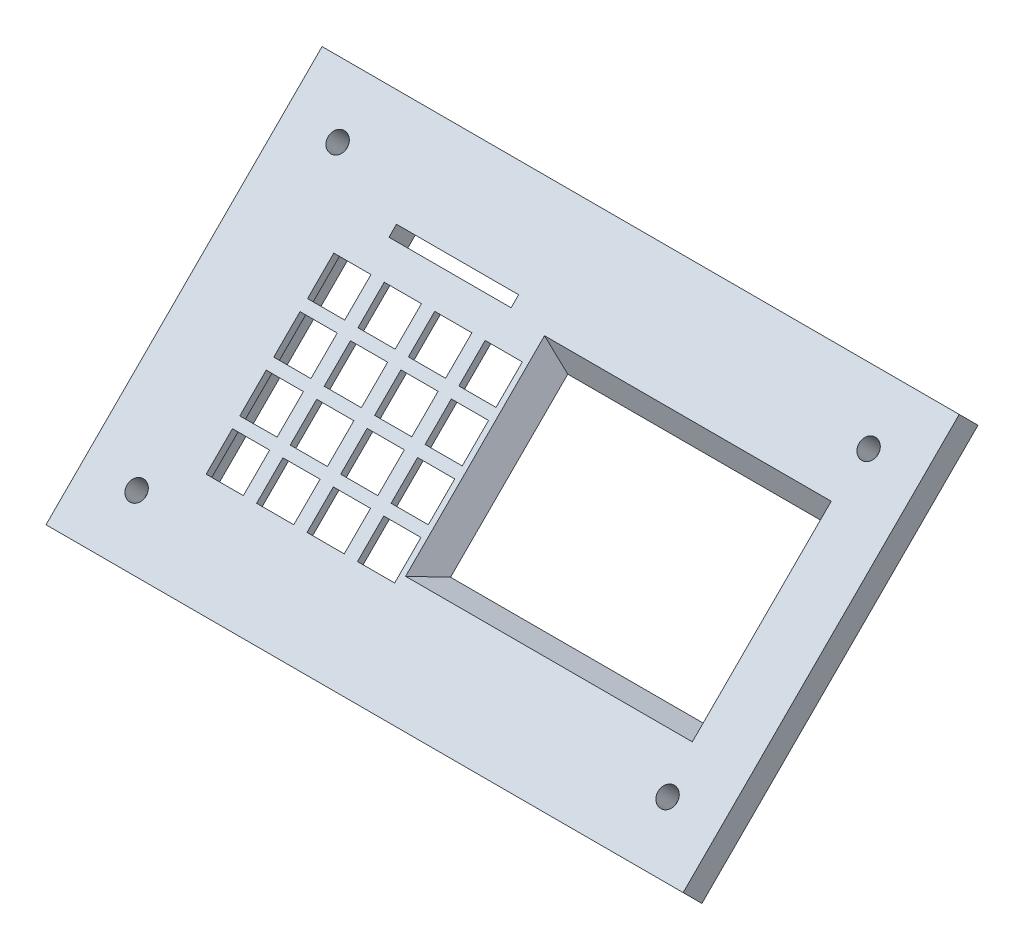
from build123d import *

# Parameters (mm, degrees)
SKETCH_1_W          = 120
SKETCH_1_H          = 73.539105243
SKETCH_1_R          = 1.8
SKETCH_1_W_2        = 48
SKETCH_1_H_2        = 31
SKETCH_1_W_3        = 23
SKETCH_1_H_3        = 2
SKETCH_1_W_4        = 7
SKETCH_1_H_4        = 7
SKETCH_1_H_5        = 7.044155877
EXTRUDE_1_DEPTH     = 5
SKETCH_2_W          = 37.5
SKETCH_2_H          = 36.110051057
CUT_EXTRUDE_1_DEPTH = 3.5


with BuildPart() as part:
    # Эскиз1 → Бобышка-Вытянуть1 (new body)
    with BuildSketch(Plane(origin=(0, 0, 0), x_dir=(1, 0, 0), z_dir=(0, 0.7071067811865477, 0.7071067811865475))):
        with Locations((60, 36.769552622)):
            Rectangle(SKETCH_1_W, SKETCH_1_H)
        with Locations(Location((10, 63.539105243, 0), (0, 0, 270))):
            Circle(SKETCH_1_R, mode=Mode.SUBTRACT)
        with Locations(Location((110, 63.539105243, 0), (0, 0, 270))):
            Circle(SKETCH_1_R, mode=Mode.SUBTRACT)
        with Locations(Location((110, 10, 0), (0, 0, 270))):
            Circle(SKETCH_1_R, mode=Mode.SUBTRACT)
        with Locations(Location((10, 10, 0), (0, 0, 270))):
            Circle(SKETCH_1_R, mode=Mode.SUBTRACT)
        with Locations((82, 36.5)):
            Rectangle(SKETCH_1_W_2, SKETCH_1_H_2, mode=Mode.SUBTRACT)
        with Locations((36.5, 57)):
            Rectangle(SKETCH_1_W_3, SKETCH_1_H_3, mode=Mode.SUBTRACT)
        with Locations((50.5, 47)):
            Rectangle(SKETCH_1_W_4, SKETCH_1_H_4, mode=Mode.SUBTRACT)
        with Locations((41, 47)):
            Rectangle(SKETCH_1_W_4, SKETCH_1_H_4, mode=Mode.SUBTRACT)
        with Locations((31.5, 47)):
            Rectangle(SKETCH_1_W_4, SKETCH_1_H_4, mode=Mode.SUBTRACT)
        with Locations((22, 47)):
            Rectangle(SKETCH_1_W_4, SKETCH_1_H_4, mode=Mode.SUBTRACT)
        with Locations((22, 38)):
            Rectangle(SKETCH_1_W_4, SKETCH_1_H_4, mode=Mode.SUBTRACT)
        Polygon((18.5, 32.5), (18.5, 25.455844123), (25.5, 25.5), (25.5, 32.5), align=None, mode=Mode.SUBTRACT)
        with Locations((22, 20)):
            Rectangle(SKETCH_1_W_4, SKETCH_1_H_4, mode=Mode.SUBTRACT)
        with Locations((31.5, 20)):
            Rectangle(SKETCH_1_W_4, SKETCH_1_H_4, mode=Mode.SUBTRACT)
        with Locations((41, 20)):
            Rectangle(SKETCH_1_W_4, SKETCH_1_H_4, mode=Mode.SUBTRACT)
        with Locations((50.5, 20)):
            Rectangle(SKETCH_1_W_4, SKETCH_1_H_4, mode=Mode.SUBTRACT)
        with Locations((50.5, 28.977922062)):
            Rectangle(SKETCH_1_W_4, SKETCH_1_H_5, mode=Mode.SUBTRACT)
        with Locations((41, 38)):
            Rectangle(SKETCH_1_W_4, SKETCH_1_H_4, mode=Mode.SUBTRACT)
        with Locations((50.5, 38)):
            Rectangle(SKETCH_1_W_4, SKETCH_1_H_4, mode=Mode.SUBTRACT)
        with Locations((31.5, 38)):
            Rectangle(SKETCH_1_W_4, SKETCH_1_H_4, mode=Mode.SUBTRACT)
        with Locations((31.5, 28.977922062)):
            Rectangle(SKETCH_1_W_4, SKETCH_1_H_5, mode=Mode.SUBTRACT)
        with Locations((41, 28.977922062)):
            Rectangle(SKETCH_1_W_4, SKETCH_1_H_5, mode=Mode.SUBTRACT)
    extrude(amount=EXTRUDE_1_DEPTH)

    # Фаска1
    # the kernel refuses this chamfer: 5.196152423, 3 mm, written as the material it takes off along each edge
    with BuildSketch(Plane(origin=(58, 18.384776311, -11.313708499), x_dir=(0.01932676561270104, -0.706974708221925, -0.7069747082219248), z_dir=(0, 0.7071067811865475, -0.7071067811865477)), Plane(origin=(106, 40.305086528, -33.234018716), x_dir=(-0.019326765612701025, -0.706974708221925, -0.7069747082219249), z_dir=(0, -0.7071067811865475, 0.7071067811865477))) as chamfer_1_piece_1:
        with BuildLine():
            Line((5.377156765, 0), (-0.239955173, 3.099864482))
            Line((-0.239955173, 3.099864482), (-0.343858811, 3.097855985))
            ThreePointArc((-0.343858811, 3.097855985), (-0.133898034, 1.549663153), (-0.103903638, -0.002008496))
            Line((-0.103903638, -0.002008496), (0.002008496, -0.103903638))
            ThreePointArc((0.002008496, -0.103903638), (2.689582631, -0.051951819), (5.379165261, -0.103903638))
            Line((5.379165261, -0.103903638), (5.377156765, 0))
        make_face()
    extrude(amount=31, mode=Mode.SUBTRACT)
    with BuildSketch(Plane(origin=(106, 18.384776311, -11.313708499), x_dir=(0, -0.6933086211987814, -0.7206407952450685), z_dir=(-1, 0, 0)), Plane(origin=(58, 40.305086528, -33.234018716), x_dir=(0, -0.7206407952450687, -0.693308621198781), z_dir=(1, 0, 0))) as chamfer_1_piece_2:
        with BuildLine():
            Line((5.377156765, 0), (-0.239955173, 3.099864482))
            Line((-0.239955173, 3.099864482), (-0.343858811, 3.097855985))
            ThreePointArc((-0.343858811, 3.097855985), (-0.133898034, 1.549663153), (-0.103903638, -0.002008496))
            Line((-0.103903638, -0.002008496), (0.002008496, -0.103903638))
            ThreePointArc((0.002008496, -0.103903638), (2.689582631, -0.051951819), (5.379165261, -0.103903638))
            Line((5.379165261, -0.103903638), (5.377156765, 0))
        make_face()
    extrude(amount=48, mode=Mode.SUBTRACT)
    with BuildSketch(Plane(origin=(106, 18.384776311, -11.313708499), x_dir=(0, -0.6933086211987814, -0.7206407952450685), z_dir=(-1, 0, 0))) as chamfer_1_piece_3a_section:
        with BuildLine():
            Line((5.377156765, 0), (-0.239955173, 3.099864482))
            Line((-0.239955173, 3.099864482), (-0.343858811, 3.097855985))
            ThreePointArc((-0.343858811, 3.097855985), (-0.133898034, 1.549663153), (-0.103903638, -0.002008496))
            Line((-0.103903638, -0.002008496), (0.002008496, -0.103903638))
            ThreePointArc((0.002008496, -0.103903638), (2.689582631, -0.051951819), (5.379165261, -0.103903638))
            Line((5.379165261, -0.103903638), (5.377156765, 0))
        make_face()
    chamfer_1_piece_3a = extrude(amount=61.442891912, mode=Mode.PRIVATE)
    chamfer_1_piece_3a = split(chamfer_1_piece_3a, bisect_by=Plane(origin=(58, 16.472259587, -11.865738078), z_dir=(-1, 0, 0)), keep=Keep.TOP, mode=Mode.PRIVATE)
    with BuildSketch(Plane(origin=(58, 8.879216281, -1.808148469), x_dir=(0.01932676561270103, -0.706974708221925, -0.7069747082219248), z_dir=(0, 0.7071067811865475, -0.7071067811865477))) as chamfer_1_piece_3b_section:
        with BuildLine():
            Line((5.377156765, 0), (-0.239955173, 3.099864482))
            Line((-0.239955173, 3.099864482), (-0.343858811, 3.097855985))
            ThreePointArc((-0.343858811, 3.097855985), (-0.133898034, 1.549663153), (-0.103903638, -0.002008496))
            Line((-0.103903638, -0.002008496), (0.002008496, -0.103903638))
            ThreePointArc((0.002008496, -0.103903638), (2.689582631, -0.051951819), (5.379165261, -0.103903638))
            Line((5.379165261, -0.103903638), (5.377156765, 0))
        make_face()
    chamfer_1_piece_3b = extrude(amount=44.442891912, mode=Mode.PRIVATE)
    chamfer_1_piece_3b = split(chamfer_1_piece_3b, bisect_by=Plane(origin=(57.037990314, 17.15250316, -12.54598165), z_dir=(0, -0.7071067811865475, 0.7071067811865477)), keep=Keep.TOP, mode=Mode.PRIVATE)
    chamfer_1_piece_3 = chamfer_1_piece_3a & chamfer_1_piece_3b
    add(chamfer_1_piece_3, mode=Mode.SUBTRACT)
    with BuildSketch(Plane(origin=(44.557108088, 40.305086528, -33.234018716), x_dir=(0, -0.7206407952450687, -0.693308621198781), z_dir=(1, 0, 0))) as chamfer_1_piece_4a_section:
        with BuildLine():
            Line((5.377156765, 0), (-0.239955173, 3.099864482))
            Line((-0.239955173, 3.099864482), (-0.343858811, 3.097855985))
            ThreePointArc((-0.343858811, 3.097855985), (-0.133898034, 1.549663153), (-0.103903638, -0.002008496))
            Line((-0.103903638, -0.002008496), (0.002008496, -0.103903638))
            ThreePointArc((0.002008496, -0.103903638), (2.689582631, -0.051951819), (5.379165261, -0.103903638))
            Line((5.379165261, -0.103903638), (5.377156765, 0))
        make_face()
    chamfer_1_piece_4a = extrude(amount=61.442891912, mode=Mode.PRIVATE)
    chamfer_1_piece_4a = split(chamfer_1_piece_4a, bisect_by=Plane(origin=(58, 39.753056949, -35.146535439), z_dir=(-1, 0, 0)), keep=Keep.TOP, mode=Mode.PRIVATE)
    with BuildSketch(Plane(origin=(58, 18.384776311, -11.313708499), x_dir=(0.01932676561270104, -0.706974708221925, -0.7069747082219248), z_dir=(0, 0.7071067811865475, -0.7071067811865477))) as chamfer_1_piece_4b_section:
        with BuildLine():
            Line((5.377156765, 0), (-0.239955173, 3.099864482))
            Line((-0.239955173, 3.099864482), (-0.343858811, 3.097855985))
            ThreePointArc((-0.343858811, 3.097855985), (-0.133898034, 1.549663153), (-0.103903638, -0.002008496))
            Line((-0.103903638, -0.002008496), (0.002008496, -0.103903638))
            ThreePointArc((0.002008496, -0.103903638), (2.689582631, -0.051951819), (5.379165261, -0.103903638))
            Line((5.379165261, -0.103903638), (5.377156765, 0))
        make_face()
    chamfer_1_piece_4b = extrude(amount=44.442891912, mode=Mode.PRIVATE)
    chamfer_1_piece_4b = split(chamfer_1_piece_4b, bisect_by=Plane(origin=(57.037990314, 39.072813376, -34.466291867), z_dir=(0, 0.7071067811865475, -0.7071067811865477)), keep=Keep.TOP, mode=Mode.PRIVATE)
    chamfer_1_piece_4 = chamfer_1_piece_4a & chamfer_1_piece_4b
    add(chamfer_1_piece_4, mode=Mode.SUBTRACT)
    with BuildSketch(Plane(origin=(106, 40.305086528, -33.234018716), x_dir=(-0.019326765612701025, -0.706974708221925, -0.7069747082219249), z_dir=(0, -0.7071067811865475, 0.7071067811865477))) as chamfer_1_piece_5a_section:
        with BuildLine():
            Line((5.377156765, 0), (-0.239955173, 3.099864482))
            Line((-0.239955173, 3.099864482), (-0.343858811, 3.097855985))
            ThreePointArc((-0.343858811, 3.097855985), (-0.133898034, 1.549663153), (-0.103903638, -0.002008496))
            Line((-0.103903638, -0.002008496), (0.002008496, -0.103903638))
            ThreePointArc((0.002008496, -0.103903638), (2.689582631, -0.051951819), (5.379165261, -0.103903638))
            Line((5.379165261, -0.103903638), (5.377156765, 0))
        make_face()
    chamfer_1_piece_5a = extrude(amount=44.442891912, mode=Mode.PRIVATE)
    chamfer_1_piece_5a = split(chamfer_1_piece_5a, bisect_by=Plane(origin=(106.962009686, 17.15250316, -12.54598165), z_dir=(0, -0.7071067811865475, 0.7071067811865477)), keep=Keep.TOP, mode=Mode.PRIVATE)
    with BuildSketch(Plane(origin=(119.442891912, 18.384776311, -11.313708499), x_dir=(0, -0.6933086211987812, -0.7206407952450685), z_dir=(-1, 0, 0))) as chamfer_1_piece_5b_section:
        with BuildLine():
            Line((5.377156765, 0), (-0.239955173, 3.099864482))
            Line((-0.239955173, 3.099864482), (-0.343858811, 3.097855985))
            ThreePointArc((-0.343858811, 3.097855985), (-0.133898034, 1.549663153), (-0.103903638, -0.002008496))
            Line((-0.103903638, -0.002008496), (0.002008496, -0.103903638))
            ThreePointArc((0.002008496, -0.103903638), (2.689582631, -0.051951819), (5.379165261, -0.103903638))
            Line((5.379165261, -0.103903638), (5.377156765, 0))
        make_face()
    chamfer_1_piece_5b = extrude(amount=61.442891912, mode=Mode.PRIVATE)
    chamfer_1_piece_5b = split(chamfer_1_piece_5b, bisect_by=Plane(origin=(106, 16.472259587, -11.865738078), z_dir=(1, 0, 0)), keep=Keep.TOP, mode=Mode.PRIVATE)
    chamfer_1_piece_5 = chamfer_1_piece_5a & chamfer_1_piece_5b
    add(chamfer_1_piece_5, mode=Mode.SUBTRACT)
    with BuildSketch(Plane(origin=(58, 40.305086528, -33.234018716), x_dir=(0, -0.7206407952450687, -0.693308621198781), z_dir=(1, 0, 0))) as chamfer_1_piece_6a_section:
        with BuildLine():
            Line((5.377156765, 0), (-0.239955173, 3.099864482))
            Line((-0.239955173, 3.099864482), (-0.343858811, 3.097855985))
            ThreePointArc((-0.343858811, 3.097855985), (-0.133898034, 1.549663153), (-0.103903638, -0.002008496))
            Line((-0.103903638, -0.002008496), (0.002008496, -0.103903638))
            ThreePointArc((0.002008496, -0.103903638), (2.689582631, -0.051951819), (5.379165261, -0.103903638))
            Line((5.379165261, -0.103903638), (5.377156765, 0))
        make_face()
    chamfer_1_piece_6a = extrude(amount=61.442891912, mode=Mode.PRIVATE)
    chamfer_1_piece_6a = split(chamfer_1_piece_6a, bisect_by=Plane(origin=(106, 39.753056949, -35.146535439), z_dir=(1, 0, 0)), keep=Keep.TOP, mode=Mode.PRIVATE)
    with BuildSketch(Plane(origin=(106, 49.810646557, -42.739578745), x_dir=(-0.019326765612701025, -0.706974708221925, -0.7069747082219249), z_dir=(0, -0.7071067811865475, 0.7071067811865477))) as chamfer_1_piece_6b_section:
        with BuildLine():
            Line((5.377156765, 0), (-0.239955173, 3.099864482))
            Line((-0.239955173, 3.099864482), (-0.343858811, 3.097855985))
            ThreePointArc((-0.343858811, 3.097855985), (-0.133898034, 1.549663153), (-0.103903638, -0.002008496))
            Line((-0.103903638, -0.002008496), (0.002008496, -0.103903638))
            ThreePointArc((0.002008496, -0.103903638), (2.689582631, -0.051951819), (5.379165261, -0.103903638))
            Line((5.379165261, -0.103903638), (5.377156765, 0))
        make_face()
    chamfer_1_piece_6b = extrude(amount=44.442891912, mode=Mode.PRIVATE)
    chamfer_1_piece_6b = split(chamfer_1_piece_6b, bisect_by=Plane(origin=(106.962009686, 39.072813376, -34.466291867), z_dir=(0, 0.7071067811865475, -0.7071067811865477)), keep=Keep.TOP, mode=Mode.PRIVATE)
    chamfer_1_piece_6 = chamfer_1_piece_6a & chamfer_1_piece_6b
    add(chamfer_1_piece_6, mode=Mode.SUBTRACT)

    # Эскиз2 → Вырез-Вытянуть1 (cut)
    with BuildSketch(Plane(origin=(0, 0, 0), x_dir=(1, 0, 0), z_dir=(0, 0.7071067811865477, 0.7071067811865475))):
        with Locations((36.25, 33.597850417)):
            Rectangle(SKETCH_2_W, SKETCH_2_H)
    extrude(amount=CUT_EXTRUDE_1_DEPTH, mode=Mode.SUBTRACT)


solid = part.part
